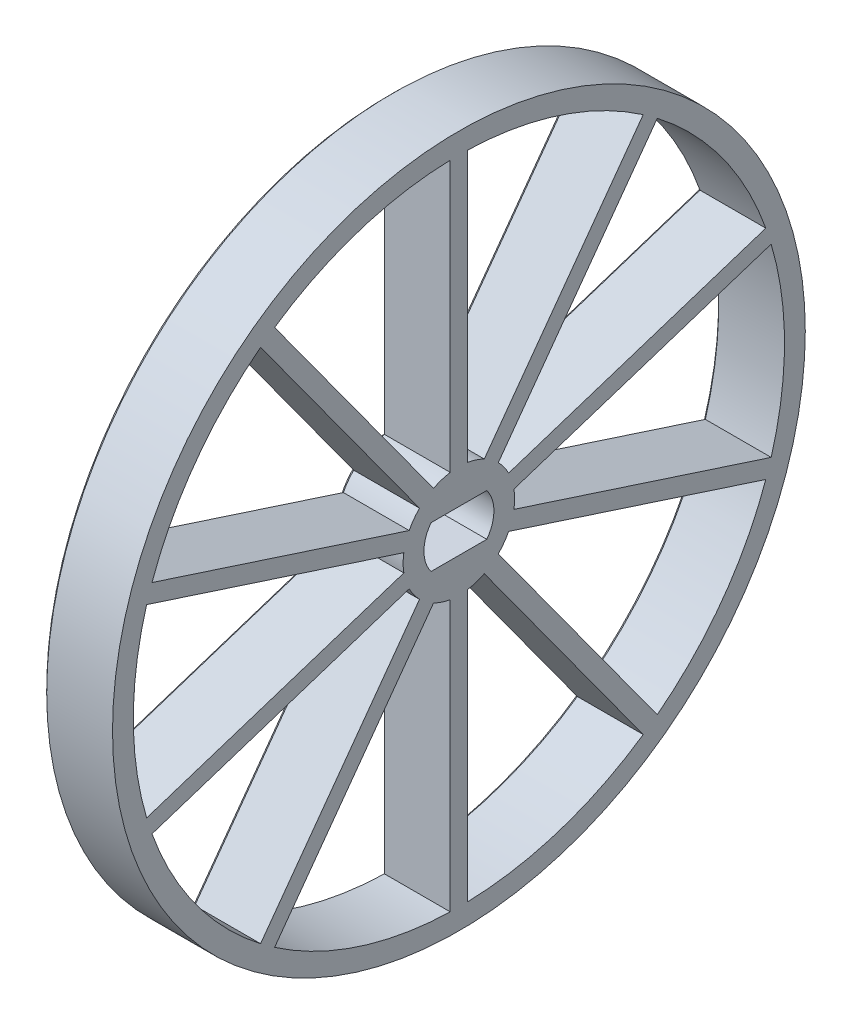
from build123d import *

# Parameters (mm, degrees)
SKETCH1_R           = 25
BOSS_EXTRUDE1_DEPTH = 5
CHAMFER2_SIZE       = 0.25


with BuildPart() as part:
    # Sketch1 → Boss-Extrude1 (new body)
    with BuildSketch(Plane(origin=(0, 0, 0), x_dir=(0, 0, -1), z_dir=(1, 0, 0))):
        Circle(SKETCH1_R)
        with BuildLine():
            ThreePointArc((-2.01246118, -1.525), (-2.525, 0), (-2.01246118, 1.525))
            Line((-2.01246118, 1.525), (2.01246118, 1.525))
            ThreePointArc((2.01246118, 1.525), (2.525, 0), (2.01246118, -1.525))
            Line((2.01246118, -1.525), (-2.01246118, -1.525))
        make_face(mode=Mode.SUBTRACT)
        with BuildLine():
            ThreePointArc((1.831503797, 3.584162223), (1.243793402, 3.828002478), (0.625, 3.97617907))
            Line((0.625, 3.97617907), (0.625, 23.49168736))
            ThreePointArc((0.625, 23.49168736), (7.261899368, 22.349828133), (13.30243176, 19.372540083))
            Line((13.30243176, 19.372540083), (1.831503797, 3.584162223))
        make_face(mode=Mode.SUBTRACT)
        with BuildLine():
            ThreePointArc((3.588435393, 1.823117228), (3.256293402, 2.36583564), (2.84277504, 2.849430658))
            Line((2.84277504, 2.849430658), (14.313703003, 18.637808518))
            ThreePointArc((14.313703003, 18.637808518), (19.011899368, 13.812953429), (22.148786721, 7.853740943))
            Line((22.148786721, 7.853740943), (3.588435393, 1.823117228))
        make_face(mode=Mode.SUBTRACT)
        with BuildLine():
            Line((3.974706636, 0.634296583), (22.535057964, 6.664920298))
            ThreePointArc((22.535057964, 6.664920298), (23.5, 0), (22.535057964, -6.664920298))
            Line((22.535057964, -6.664920298), (3.974706636, -0.634296583))
            ThreePointArc((3.974706636, -0.634296583), (4.025, 0), (3.974706636, 0.634296583))
        make_face(mode=Mode.SUBTRACT)
        with BuildLine():
            ThreePointArc((2.84277504, -2.849430658), (3.256293402, -2.36583564), (3.588435393, -1.823117228))
            Line((3.588435393, -1.823117228), (22.148786721, -7.853740943))
            ThreePointArc((22.148786721, -7.853740943), (19.011899368, -13.812953429), (14.313703003, -18.637808518))
            Line((14.313703003, -18.637808518), (2.84277504, -2.849430658))
        make_face(mode=Mode.SUBTRACT)
        with BuildLine():
            ThreePointArc((0.625, -3.97617907), (1.243793402, -3.828002478), (1.831503797, -3.584162223))
            Line((1.831503797, -3.584162223), (13.30243176, -19.372540083))
            ThreePointArc((13.30243176, -19.372540083), (7.261899368, -22.349828133), (0.625, -23.49168736))
            Line((0.625, -23.49168736), (0.625, -3.97617907))
        make_face(mode=Mode.SUBTRACT)
        with BuildLine():
            ThreePointArc((-1.831503797, -3.584162223), (-1.243793402, -3.828002478), (-0.625, -3.97617907))
            Line((-0.625, -3.97617907), (-0.625, -23.49168736))
            ThreePointArc((-0.625, -23.49168736), (-7.261899368, -22.349828133), (-13.30243176, -19.372540083))
            Line((-13.30243176, -19.372540083), (-1.831503797, -3.584162223))
        make_face(mode=Mode.SUBTRACT)
        with BuildLine():
            ThreePointArc((-3.588435393, -1.823117228), (-3.256293402, -2.36583564), (-2.84277504, -2.849430658))
            Line((-2.84277504, -2.849430658), (-14.313703003, -18.637808518))
            ThreePointArc((-14.313703003, -18.637808518), (-19.011899368, -13.812953429), (-22.148786721, -7.853740943))
            Line((-22.148786721, -7.853740943), (-3.588435393, -1.823117228))
        make_face(mode=Mode.SUBTRACT)
        with BuildLine():
            ThreePointArc((-3.974706636, 0.634296583), (-4.025, 0), (-3.974706636, -0.634296583))
            Line((-3.974706636, -0.634296583), (-22.535057964, -6.664920298))
            ThreePointArc((-22.535057964, -6.664920298), (-23.5, 0), (-22.535057964, 6.664920298))
            Line((-22.535057964, 6.664920298), (-3.974706636, 0.634296583))
        make_face(mode=Mode.SUBTRACT)
        with BuildLine():
            ThreePointArc((-2.84277504, 2.849430658), (-3.256293402, 2.36583564), (-3.588435393, 1.823117228))
            Line((-3.588435393, 1.823117228), (-22.148786721, 7.853740943))
            ThreePointArc((-22.148786721, 7.853740943), (-19.011899368, 13.812953429), (-14.313703003, 18.637808518))
            Line((-14.313703003, 18.637808518), (-2.84277504, 2.849430658))
        make_face(mode=Mode.SUBTRACT)
        with BuildLine():
            ThreePointArc((-0.625, 3.97617907), (-1.243793402, 3.828002478), (-1.831503797, 3.584162223))
            Line((-1.831503797, 3.584162223), (-13.30243176, 19.372540083))
            ThreePointArc((-13.30243176, 19.372540083), (-7.261899368, 22.349828133), (-0.625, 23.49168736))
            Line((-0.625, 23.49168736), (-0.625, 3.97617907))
        make_face(mode=Mode.SUBTRACT)
    extrude(amount=BOSS_EXTRUDE1_DEPTH)

    # Chamfer2
    chamfer2_edges = [part.edges().sort_by_distance(p)[0] for p in [
        (0, 0, 25),
        (0, 13.733933215, -0.625),
        (0, 22.349828133, -7.261899368),
        (0, 11.478351153, -7.566967778),
        (0, 3.828002478, -1.243793402),
        (0, 11.478351153, 7.566967778),
        (0, 22.349828133, 7.261899368),
        (0, 13.733933215, 0.625),
        (0, 3.828002478, 1.243793402),
        (0, 4.838429086, 12.868611057),
        (0, 13.812953429, 19.011899368),
        (0, 10.743619588, 8.578239021),
        (0, 2.36583564, 3.256293402),
        (0, -3.64960844, 13.2548823),
        (0, 0, 23.5),
        (0, 3.64960844, 13.2548823),
        (0, 0, 4.025),
        (0, -10.743619588, 8.578239021),
        (0, -13.812953429, 19.011899368),
        (0, -4.838429086, 12.868611057),
        (0, -2.36583564, 3.256293402),
        (0, -13.733933215, 0.625),
        (0, -22.349828133, 7.261899368),
        (0, -11.478351153, 7.566967778),
        (0, -3.828002478, 1.243793402),
        (0, -11.478351153, -7.566967778),
        (0, -22.349828133, -7.261899368),
        (0, -13.733933215, -0.625),
        (0, -3.828002478, -1.243793402),
        (0, -4.838429086, -12.868611057),
        (0, -13.812953429, -19.011899368),
        (0, -10.743619588, -8.578239021),
        (0, -2.36583564, -3.256293402),
        (0, 2.36583564, -3.256293402),
        (0, 10.743619588, -8.578239021),
        (0, 13.812953429, -19.011899368),
        (0, 4.838429086, -12.868611057),
        (0, 3.64960844, -13.2548823),
        (0, 0, -23.5),
        (0, -3.64960844, -13.2548823),
        (0, 0, -4.025),
        (0, 1.525, 0),
        (0, 0, -2.525),
        (0, -1.525, 0),
        (0, 0, 2.525),
    ]]
    chamfer(chamfer2_edges, length=CHAMFER2_SIZE)


solid = part.part
